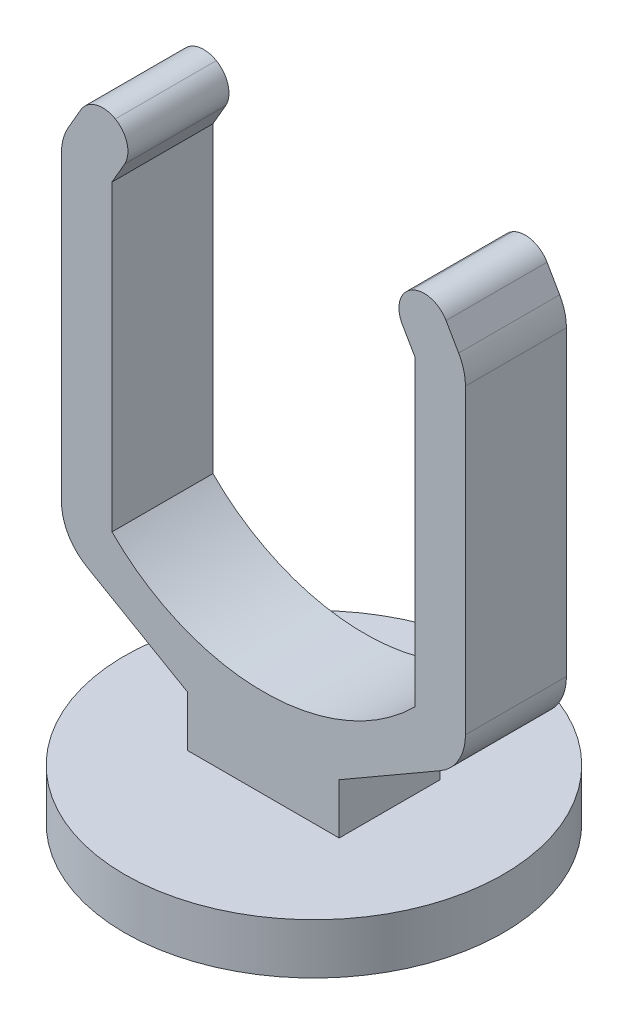
from build123d import *

# Parameters (mm, degrees)
SKETCH_1_R           = 37.5
EXTRUDE_1_DEPTH      = 10
EXTRUDE_2_DEPTH      = 10
EXTRUDE_2_DEPTH_BACK = 10
FILLET_1_R           = 5
FILLET_2_R           = 10


with BuildPart() as part:
    # 草图1 → 凸台-拉伸1 (new body)
    with BuildSketch(Plane(origin=(0, 0, 0), x_dir=(1, 0, 0), z_dir=(0, 1, 0))):
        with Locations(Location((0, 0, 0), (0, 0, 270))):
            Circle(SKETCH_1_R)
    extrude(amount=EXTRUDE_1_DEPTH)

    # 草图2 → 凸台-拉伸2 (add, two sides: drawn at the far end of the back side and taken through both)
    with BuildSketch(Plane.XY.offset(-EXTRUDE_2_DEPTH_BACK)):
        with BuildLine():
            Line((15, 0), (15, 20))
            Line((15, 20), (40, 34.43375673))
            Line((40, 34.43375673), (40, 102.679491924))
            Line((40, 102.679491924), (33.660254038, 113.660254038))
            Line((33.660254038, 113.660254038), (25, 108.660254038))
            Line((25, 108.660254038), (30, 100))
            Line((30, 100), (30, 40))
            ThreePointArc((30, 40), (0, 27.573593129), (-30, 40))
            Line((-30, 40), (-30, 100))
            Line((-30, 100), (-25, 108.660254038))
            Line((-25, 108.660254038), (-33.660254038, 113.660254038))
            Line((-33.660254038, 113.660254038), (-40, 102.679491924))
            Line((-40, 102.679491924), (-40, 34.43375673))
            Line((-40, 34.43375673), (-15, 20))
            Line((-15, 20), (-15, 0))
            Line((-15, 0), (15, 0))
        make_face()
    extrude(amount=EXTRUDE_2_DEPTH + EXTRUDE_2_DEPTH_BACK)

    # 圆角1
    fillet_1_edges = [part.edges().sort_by_distance(p)[0] for p in [
        (33.660254038, 113.660254038, 0),
        (25, 108.660254038, 0),
        (-25, 108.660254038, 0),
        (-33.660254038, 113.660254038, 0),
    ]]
    fillet(fillet_1_edges, radius=FILLET_1_R - 0.0001)  # a hair under: the kernel refuses the full size

    # 圆角2
    fillet_2_edges = [part.edges().sort_by_distance(p)[0] for p in [
        (-40, 34.43375673, 0),
        (-40, 102.679491924, 0),
        (40, 102.679491924, 0),
        (40, 34.43375673, 0),
    ]]
    fillet(fillet_2_edges, radius=FILLET_2_R)


solid = part.part
